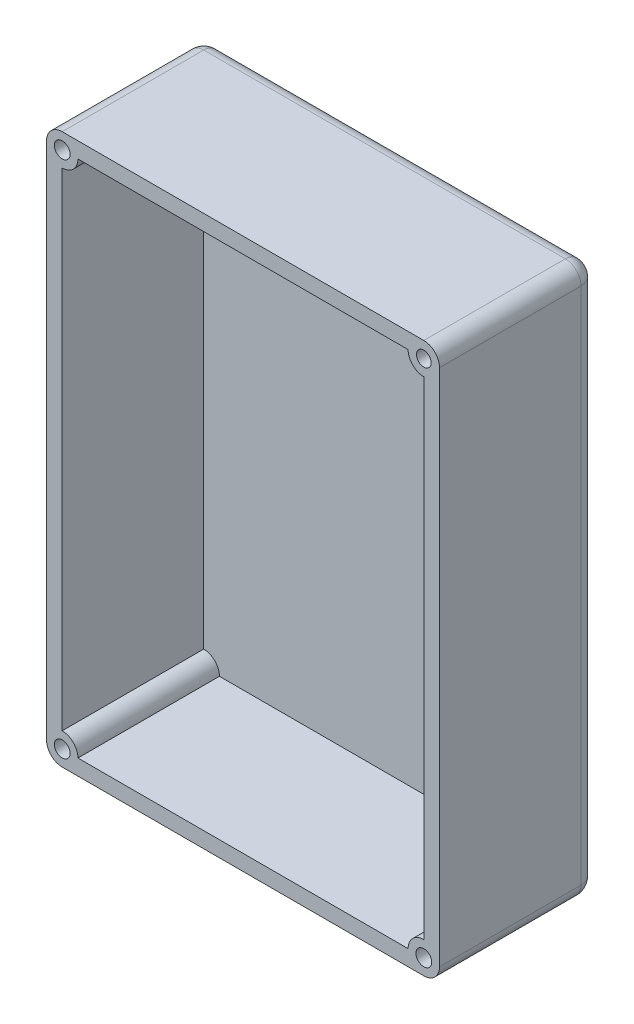
from build123d import *

# Parameters (mm, degrees)
SKETCH1_W           = 250
SKETCH1_H           = 350
BOSS_EXTRUDE1_DEPTH = 100
SKETCH2_W           = 230
SKETCH2_H           = 330
CUT_EXTRUDE1_DEPTH  = 90
FILLET1_R           = 10
SKETCH3_W           = 10
SKETCH3_H           = 10
BOSS_EXTRUDE2_DEPTH = 90
SKETCH4_W           = 10
SKETCH4_H           = 9.995398269
BOSS_EXTRUDE3_DEPTH = 90
SKETCH5_W           = 10
SKETCH5_H           = 10
BOSS_EXTRUDE4_DEPTH = 90
FILLET2_R           = 10
FILLET3_R           = 10
SKETCH6_R           = 4.668020142
CUT_EXTRUDE2_DEPTH  = 10
SKETCH7_R           = 5
CUT_EXTRUDE3_DEPTH  = 10
SKETCH8_R           = 5
CUT_EXTRUDE4_DEPTH  = 10
SKETCH9_R           = 5
CUT_EXTRUDE5_DEPTH  = 10


# Some blends are built 0.0001 mm under size
with BuildPart() as part:
    # Sketch1 → Boss-Extrude1 (new body)
    with BuildSketch(Plane.XY):
        with Locations((125, -175)):
            Rectangle(SKETCH1_W, SKETCH1_H)
    extrude(amount=-BOSS_EXTRUDE1_DEPTH)

    # Sketch2 → Cut-Extrude1 (cut)
    with BuildSketch(Plane.XY):
        with Locations((125, -175)):
            Rectangle(SKETCH2_W, SKETCH2_H)
    extrude(amount=-CUT_EXTRUDE1_DEPTH, mode=Mode.SUBTRACT)

    # Fillet1
    fillet1_edges = [part.edges().sort_by_distance(p)[0] for p in [
        (250, -175, -100),
        (125, 0, -100),
        (0, -175, -100),
        (125, -350, -100),
        (0, 0, -50),
        (250, 0, -50),
        (250, -350, -50),
        (0, -350, -50),
    ]]
    fillet(fillet1_edges, radius=FILLET1_R)

    # Sketch3 → Boss-Extrude2 (add)
    with BuildSketch(Plane.XY.offset(-90)):
        with Locations((15, -335)):
            Rectangle(SKETCH3_W, SKETCH3_H)
    extrude(amount=BOSS_EXTRUDE2_DEPTH)

    # Sketch4 → Boss-Extrude3 (add)
    with BuildSketch(Plane.XY.offset(-90)):
        with Locations((235, -335.002300866)):
            Rectangle(SKETCH4_W, SKETCH4_H)
    extrude(amount=BOSS_EXTRUDE3_DEPTH)

    # Sketch5 → Boss-Extrude4 (add)
    with BuildSketch(Plane.XY.offset(-90)):
        with Locations((235, -15)):
            Rectangle(SKETCH5_W, SKETCH5_H)
        with Locations((15, -15)):
            Rectangle(SKETCH5_W, SKETCH5_H)
    extrude(amount=BOSS_EXTRUDE4_DEPTH)

    # Fillet2
    fillet2_edges = [part.edges().sort_by_distance(p)[0] for p in [
        (230, -20, -45),
    ]]
    fillet(fillet2_edges, radius=FILLET2_R - 0.0001)  # a hair under: the kernel refuses the full size

    # Fillet3
    # the kernel refuses this fillet: 10 mm, written as the material it takes off along each edge
    with BuildSketch(Plane(origin=(230, -330.004601731, -90), x_dir=(1, 0, 0), z_dir=(0, 0, 1))) as fillet3_piece_1:
        with BuildLine():
            CenterArc((9.999998941, -10), FILLET3_R, 90, 89.973634023)
            Line((0, -9.995398269), (0, 0))
            Line((0, 0), (9.999998941, 0))
        make_face()
    extrude(amount=114.999997353, mode=Mode.SUBTRACT)
    with BuildSketch(Plane(origin=(20, -330, -90), x_dir=(0, -1, 0), z_dir=(0, 0, 1))) as fillet3_piece_2:
        with BuildLine():
            CenterArc((FILLET3_R, -FILLET3_R), FILLET3_R, 90, 90)
            Line((0, -FILLET3_R), (0, 0))
            Line((0, 0), (FILLET3_R, 0))
        make_face()
    extrude(amount=115, mode=Mode.SUBTRACT)
    with BuildSketch(Plane(origin=(20, -20, -90), x_dir=(0, 1, 0), z_dir=(0, 0, 1))) as fillet3_piece_3:
        with BuildLine():
            CenterArc((FILLET3_R, FILLET3_R), FILLET3_R, 180, 90)
            Line((0, FILLET3_R), (0, 0))
            Line((0, 0), (FILLET3_R, 0))
        make_face()
    extrude(amount=115, mode=Mode.SUBTRACT)

    # Sketch6 → Cut-Extrude2 (cut)
    with BuildSketch(Plane.XY):
        with Locations((240, -10)):
            Circle(SKETCH6_R)
    extrude(amount=-CUT_EXTRUDE2_DEPTH, mode=Mode.SUBTRACT)

    # Sketch7 → Cut-Extrude3 (cut)
    with BuildSketch(Plane.XY):
        with Locations((10, -10)):
            Circle(SKETCH7_R)
    extrude(amount=-CUT_EXTRUDE3_DEPTH, mode=Mode.SUBTRACT)

    # Sketch8 → Cut-Extrude4 (cut)
    with BuildSketch(Plane.XY):
        with Locations((239.999998941, -340.004601731)):
            Circle(SKETCH8_R)
    extrude(amount=-CUT_EXTRUDE4_DEPTH, mode=Mode.SUBTRACT)

    # Sketch9 → Cut-Extrude5 (cut)
    with BuildSketch(Plane.XY):
        with Locations((10, -340)):
            Circle(SKETCH9_R)
    extrude(amount=-CUT_EXTRUDE5_DEPTH, mode=Mode.SUBTRACT)


solid = part.part
